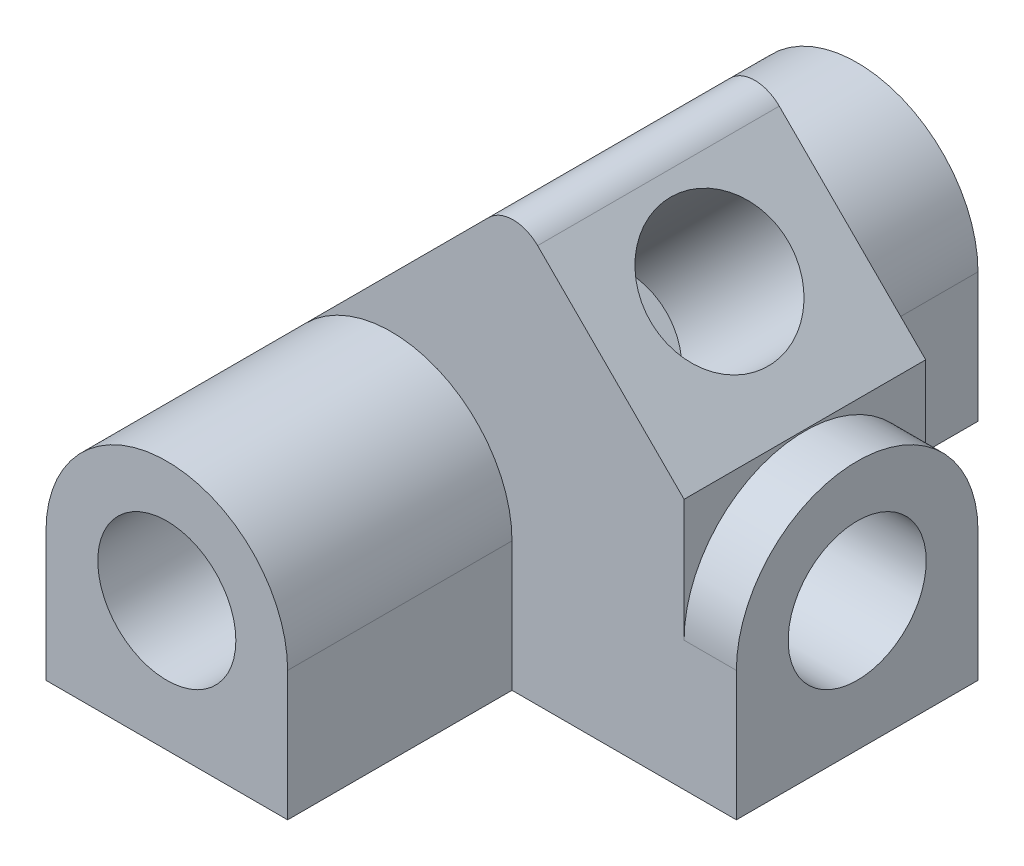
from build123d import *

# Parameters (mm, degrees)
DODANIE_WYCI_GNI_CIE1_DEPTH      = 20
DODANIE_WYCI_GNI_CIE1_DEPTH_BACK = 20
SZKIC1_R                         = 7
SZKIC1_R_2                       = 4
DODANIE_WYCI_GNI_CIE2_DEPTH      = 10
DODANIE_WYCI_GNI_CIE2_DEPTH_BACK = 10
SZKIC2_R                         = 4
DODANIE_WYCI_GNI_CIE4_START      = -7
SZKIC3_W                         = 14
SZKIC3_H                         = 14
DODANIE_WYCI_GNI_CIE4_DEPTH      = 17
SZKIC9_R                         = 7
DODANIE_WYCI_GNI_CIE6_DEPTH      = 20
SZKIC4_R                         = 4
WYTNIJ_WYCI_GNI_CIE1_DEPTH       = 10
DODANIE_WYCI_GNI_CIE7_REACH      = 39.401
DODANIE_WYCI_GNI_CIE8_START      = -7
DODANIE_WYCI_GNI_CIE8_DEPTH      = 14
SZKIC11_R                        = 4
WYTNIJ_WYCI_GNI_CIE2_DEPTH       = 10
SZKIC12_R                        = 4
WYTNIJ_WYCI_GNI_CIE3_DEPTH       = 40.84971769
ZAOKR_GLENIE1_R                  = 2
WYTNIJ_WYCI_GNI_CIE4_DEPTH       = 1


with BuildPart() as part:
    # Szkic1 → Dodanie-wyciągnięcie1 (new, two sides: drawn at the far end of the back side and taken through both)
    with BuildSketch(Plane.XY.offset(-DODANIE_WYCI_GNI_CIE1_DEPTH_BACK)):
        Circle(SZKIC1_R)
        Circle(SZKIC1_R_2, mode=Mode.SUBTRACT)
    extrude(amount=DODANIE_WYCI_GNI_CIE1_DEPTH + DODANIE_WYCI_GNI_CIE1_DEPTH_BACK)

    # Szkic2 → Dodanie-wyciągnięcie2 (add, two sides: drawn at the far end of the back side and taken through both)
    with BuildSketch(Plane.XY.offset(-DODANIE_WYCI_GNI_CIE2_DEPTH_BACK)):
        Circle(SZKIC2_R)
    extrude(amount=DODANIE_WYCI_GNI_CIE2_DEPTH + DODANIE_WYCI_GNI_CIE2_DEPTH_BACK)

    # Szkic3 → Dodanie-wyciągnięcie4 (add)
    with BuildSketch(Plane(origin=(4.949747468, 4.949747468, 0), x_dir=(0, 0, 1), z_dir=(0.7071067811865438, 0.7071067811865512, 0)).offset(DODANIE_WYCI_GNI_CIE4_START)):
        Rectangle(SZKIC3_W, SZKIC3_H)
    extrude(amount=DODANIE_WYCI_GNI_CIE4_DEPTH)

    # Szkic9 → Dodanie-wyciągnięcie6 (add)
    with BuildSketch(Plane(origin=(0, 0, 0), x_dir=(0, 0, -1), z_dir=(1, 0, 0))):
        Circle(SZKIC9_R)
    extrude(amount=DODANIE_WYCI_GNI_CIE6_DEPTH)

    # Szkic4 → Wytnij-wyciągnięcie1 (cut)
    with BuildSketch(Plane(origin=(12.02081528, 12.02081528, 0), x_dir=(0, 0, -1), z_dir=(0.7071067811865438, 0.7071067811865513, 0))):
        with Locations(Location((0, 0, 0), (0, 0, 90))):
            Circle(SZKIC4_R)
    extrude(amount=-WYTNIJ_WYCI_GNI_CIE1_DEPTH, mode=Mode.SUBTRACT)

    # Szkic10 → Dodanie-wyciągnięcie7 (add, up to next)
    with BuildSketch(Plane(origin=(0, -7.5, 0), x_dir=(1, 0, 0), z_dir=(0, 1, 0)), mode=Mode.PRIVATE) as dodanie_wyci_gni_cie7_sk1:
        Polygon((-7, 20), (-7, -20), (7, -20), (7, -7), (20, -7), (20, 7), (7, 7), (7, 20), align=None)
    dodanie_wyci_gni_cie7_tool1 = extrude(dodanie_wyci_gni_cie7_sk1.sketch, amount=DODANIE_WYCI_GNI_CIE7_REACH, mode=Mode.PRIVATE) - part.part
    add(dodanie_wyci_gni_cie7_tool1.solids().sort_by_distance((3.311321, -7.5, 0))[0])

    # Dodanie-wyciągnięcie8: read off the stored shape, not the designer's step
    # Dodanie-wyciągnięcie8 outline → Dodanie-wyciągnięcie8 (add)
    with BuildSketch(Plane.XY.offset(DODANIE_WYCI_GNI_CIE8_START)):
        Polygon((16.970562748, -2), (16.970562748, 7.071067812), (9.899494937, 0), (8, -1.899494937), (8, -2), align=None)
    extrude(amount=DODANIE_WYCI_GNI_CIE8_DEPTH)

    # Szkic11 → Wytnij-wyciągnięcie2 (cut)
    with BuildSketch(Plane(origin=(20, 0, 0), x_dir=(0, 0, -1), z_dir=(1, 0, 0))):
        Circle(SZKIC11_R)
    extrude(amount=-WYTNIJ_WYCI_GNI_CIE2_DEPTH, mode=Mode.SUBTRACT)

    # Szkic12 → Wytnij-wyciągnięcie3 (cut, through all)
    with BuildSketch(Plane.XY.offset(10)):
        Circle(SZKIC12_R)
    extrude(amount=-WYTNIJ_WYCI_GNI_CIE3_DEPTH, mode=Mode.SUBTRACT)

    # Zaokrąglenie1
    zaokr_glenie1_edges = [part.edges().sort_by_distance(p)[0] for p in [
        (7.071067812, 16.970562748, 0),
    ]]
    fillet(zaokr_glenie1_edges, radius=ZAOKR_GLENIE1_R)

    # Szkic14 → Wytnij-wyciągnięcie4 (cut, along a direction that is not the sketch's normal)
    with BuildSketch(Plane(origin=(-4.949747468, 4.949747468, 0), x_dir=(0, 0, 1), z_dir=(-0.7071067811865513, 0.7071067811865438, 0))):
        Polygon((-2.075961538, 12.525), (2.564423077, 12.525), (2.564423077, 10.815384615), (-0.366346154, 10.815384615), (-0.366346154, 8.983653846), (2.564423077, 8.983653846), (2.564423077, 7.274038462), (-0.366346154, 7.274038462), (-0.366346154, 3), (-2.075961538, 3), align=None)
    extrude(amount=-WYTNIJ_WYCI_GNI_CIE4_DEPTH, dir=(0, 1, 0), mode=Mode.SUBTRACT)


solid = part.part
